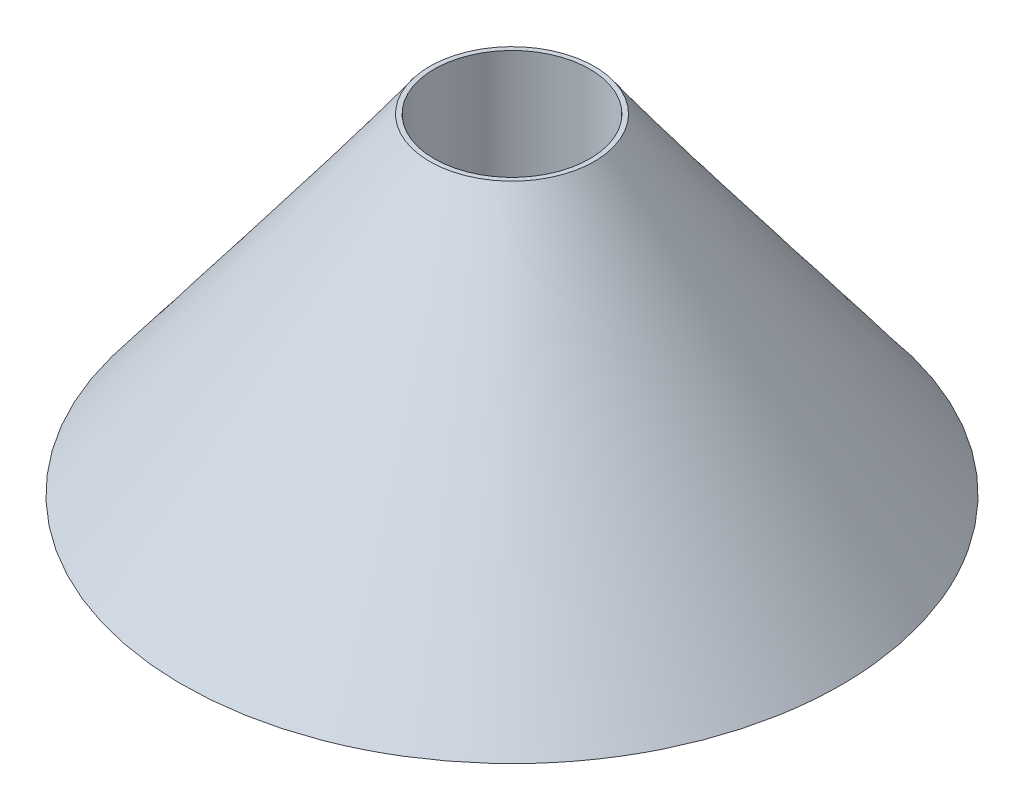
from build123d import *

# Parameters (mm, degrees)
SKETCH4_R          = 0.94375
CUT_EXTRUDE1_DEPTH = 2


with BuildPart() as part:
    # Loft1: read off the stored shape, not the designer's step
    # Loft1: loft between two sections, ruled curve by curve
    loft1_from = [
        Edge.make_bspline([(-3.801107476, 0, -1.245625127), (-6.292357729, 0, 6.356589825), (1.309857223, 0, 8.847840079), (3.801107476, 0, 1.245625127), (6.292357729, 0, -6.356589825), (-1.309857223, 0, -8.847840079), (-3.801107476, 0, -1.245625127)], [0, 0, 0, 0, 0.5, 0.5, 0.5, 1, 1, 1, 1], 3, [1, 0.333333333, 0.333333333, 1, 0.333333333, 0.333333333, 1]),
    ]
    loft1_to = [
        Edge.make_bspline([(-0.800815003, 4, -0.598911789), (-1.998638582, 4, 1.002718216), (-0.397008576, 4, 2.200541795), (0.800815003, 4, 0.598911789), (1.998638582, 4, -1.002718216), (0.397008576, 4, -2.200541795), (-0.800815003, 4, -0.598911789)], [0, 0, 0, 0, 0.5, 0.5, 0.5, 1, 1, 1, 1], 3, [1, 0.333333333, 0.333333333, 1, 0.333333333, 0.333333333, 1]),
    ]
    loft1 = Solid(Shell([*[Face.make_surface_from_curves(loft1_from[k], loft1_to[k]) for k in range(1)], Face(Wire(loft1_from)), Face(Wire(loft1_to))]))
    add(loft1)

    # Sketch4 → Cut-Extrude1 (cut)
    with BuildSketch(Plane(origin=(0, 4, 0), x_dir=(1, 0, 0), z_dir=(0, 1, 0))):
        with Locations(Location((0, 0, 0), (0, 0, 270))):
            Circle(SKETCH4_R)
    extrude(amount=-CUT_EXTRUDE1_DEPTH, mode=Mode.SUBTRACT)


solid = part.part
